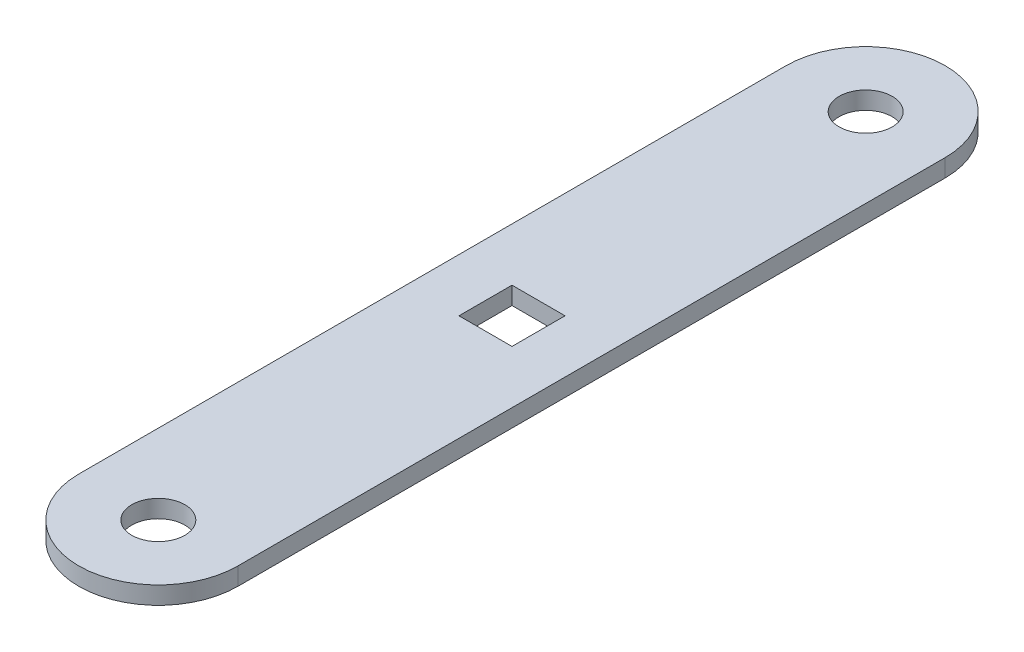
from build123d import *

# Parameters (mm, degrees)
BOSS_EXTRUDE1_DEPTH = 50
SKETCH3_R           = 75
CUT_EXTRUDE2_DEPTH  = 250
SKETCH2_R           = 75
CUT_EXTRUDE4_DEPTH  = 1247.495086232
SKETCH4_W           = 150
SKETCH4_H           = 150
CUT_EXTRUDE5_DEPTH  = 1247.495086232


with BuildPart() as part:
    # Sketch1 → Boss-Extrude1 (new body)
    with BuildSketch(Plane(origin=(0, 0, 0), x_dir=(1, 0, 0), z_dir=(0, 1, 0))):
        with BuildLine():
            Line((-225, 1000), (-225, -1000))
            ThreePointArc((-225, -1000), (0, -1225), (225, -1000))
            Line((225, -1000), (225, 1000))
            ThreePointArc((225, 1000), (0, 1225), (-225, 1000))
        make_face()
    extrude(amount=BOSS_EXTRUDE1_DEPTH)

    # Sketch3 → Cut-Extrude2 (cut)
    with BuildSketch(Plane(origin=(0, 50, 0), x_dir=(1, 0, 0), z_dir=(0, 1, 0))):
        with Locations((0, 1000)):
            Circle(SKETCH3_R)
    extrude(amount=-CUT_EXTRUDE2_DEPTH, mode=Mode.SUBTRACT)

    # Sketch2 → Cut-Extrude4 (cut, through all)
    with BuildSketch(Plane(origin=(0, 50, 0), x_dir=(1, 0, 0), z_dir=(0, 1, 0))):
        with Locations((0, -1000)):
            Circle(SKETCH2_R)
    extrude(amount=-CUT_EXTRUDE4_DEPTH, mode=Mode.SUBTRACT)

    # Sketch4 → Cut-Extrude5 (cut, through all)
    with BuildSketch(Plane(origin=(0, 50, 0), x_dir=(1, 0, 0), z_dir=(0, 1, 0))):
        Rectangle(SKETCH4_W, SKETCH4_H)
    extrude(amount=-CUT_EXTRUDE5_DEPTH, mode=Mode.SUBTRACT)


solid = part.part
